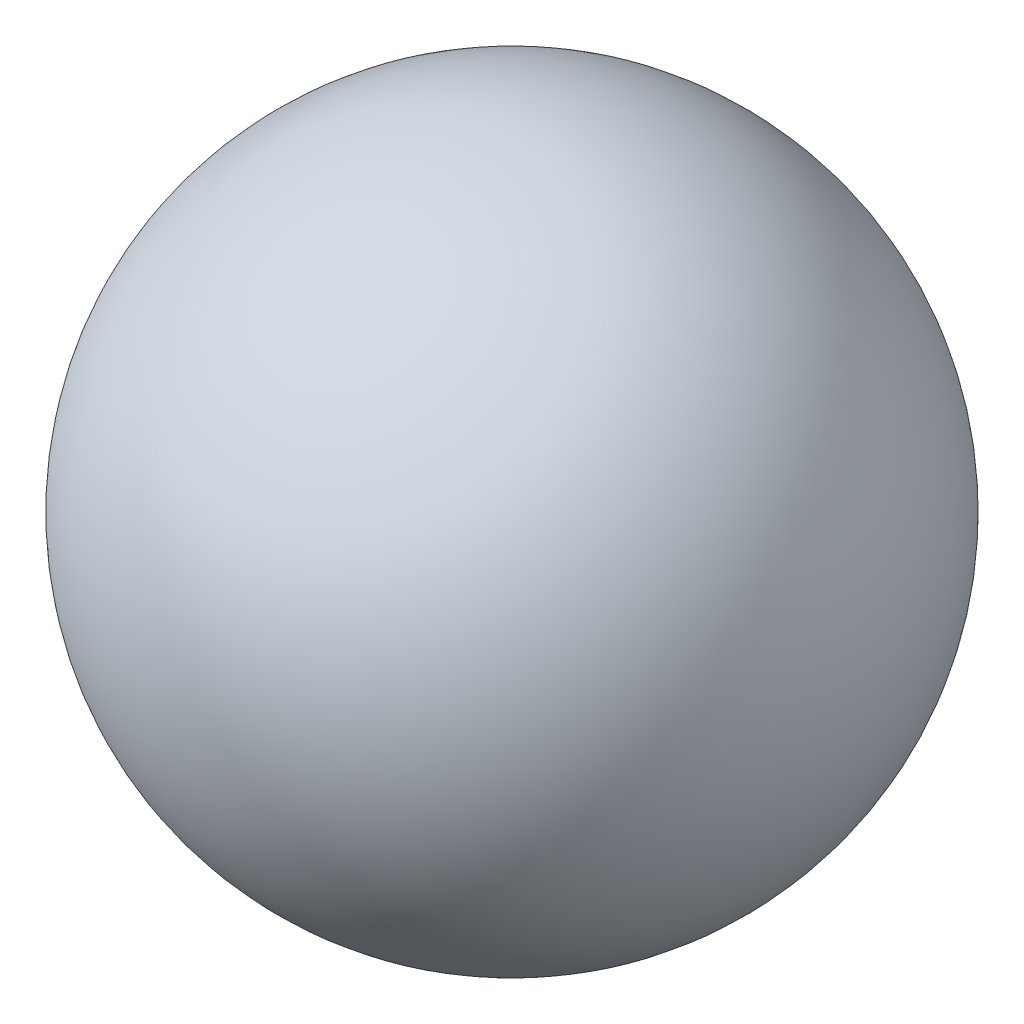
from build123d import *


with BuildPart() as part:
    # Sketch2 → Revolve1 (revolve)
    with BuildSketch(Plane.XY):
        with BuildLine():
            Line((0, 10), (0, -10))
            ThreePointArc((0, -10), (10, 0), (0, 10))
        make_face()
    revolve(axis=Axis((0, 0, 0), (0, 1, 0)))


solid = part.part
